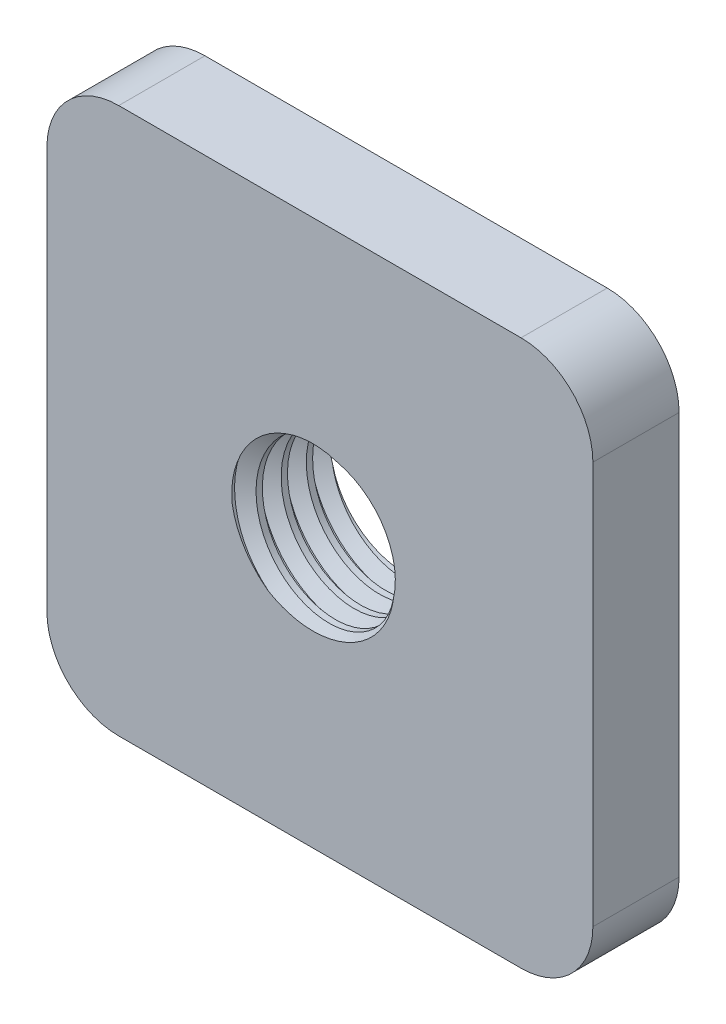
from build123d import *

# Parameters (mm, degrees)
SKETCH1_R           = 5.25
BOSS_EXTRUDE1_DEPTH = 6
THREAD1_PITCH       = 1.75


with BuildPart() as part:
    # Sketch1 → Boss-Extrude1 (new body)
    with BuildSketch(Plane.XY):
        with BuildLine():
            Line((-5, 0), (-33, 0))
            ThreePointArc((-33, 0), (-36.535533906, 1.464466094), (-38, 5))
            Line((-38, 5), (-38, 33))
            ThreePointArc((-38, 33), (-36.535533906, 36.535533906), (-33, 38))
            Line((-33, 38), (-5, 38))
            ThreePointArc((-5, 38), (-1.464466094, 36.535533906), (0, 33))
            Line((0, 33), (0, 5))
            ThreePointArc((0, 5), (-1.464466094, 1.464466094), (-5, 0))
        make_face()
        with Locations((-19, 19)):
            Circle(SKETCH1_R, mode=Mode.SUBTRACT)
    extrude(amount=BOSS_EXTRUDE1_DEPTH)

    # Thread1: the profile of Thread Profile1 profile screwed along a right-hand helix of 11.428571 turns, 10 arcs to a turn; built about Z, then put on its axis
    thread1_z = Axis((0, 0, 0), (0, 0, 1))
    thread1_corners = [(5.2497, 0, -0.000173205), (6.197215281, 0, 0.546874998), (6.197215281, 0, 0.765624998), (5.2497, 0, 1.3126732)]
    with BuildLine(mode=Mode.PRIVATE) as thread1_profile:
        Line(thread1_corners[0], thread1_corners[1])
        Line(thread1_corners[1], thread1_corners[2])
        Line(thread1_corners[2], thread1_corners[3])
        Line(thread1_corners[3], thread1_corners[0])
    thread1_cap = Face(thread1_profile.wire())
    thread1_turn_angles = [0, 18, 36, 54, 72, 90, 108, 126, 144, 162, 180, 198, 216, 234, 252, 270, 288, 306, 324, 342, 360]
    thread1_turn_weights = [1, 0.9510565162951535, 1, 0.9510565162951535, 1, 0.9510565162951535, 1, 0.9510565162951535, 1, 0.9510565162951535, 1, 0.9510565162951535, 1, 0.9510565162951535, 1, 0.9510565162951535, 1, 0.9510565162951535, 1, 0.9510565162951535, 1]
    thread1_turn_rails = [Edge.make_bspline([Vector(p[0], p[1], 0).rotate(thread1_z, thread1_turn_angles[k]) / thread1_turn_weights[k] + Vector(0, 0, p[2] + THREAD1_PITCH * thread1_turn_angles[k] / 360) for k in range(21)], [0, 0, 0, 1, 1, 2, 2, 3, 3, 4, 4, 5, 5, 6, 6, 7, 7, 8, 8, 9, 9, 10, 10, 10], 2, thread1_turn_weights) for p in thread1_corners]
    thread1_turn_sides = [Face.make_surface_from_curves(thread1_turn_rails[p[0]], thread1_turn_rails[p[1]]) for p in [(0, 1), (1, 2), (2, 3), (3, 0)]]
    thread1_last_angles = [3960, 3978, 3996, 4014, 4032, 4050, 4068, 4086, 4104, 4109.142857143, 4114.285714286]
    thread1_last_weights = [1, 0.9510565162951535, 1, 0.9510565162951535, 1, 0.9510565162951535, 1, 0.9510565162951535, 1, 0.9959742939952387, 1]
    thread1_last_rails = [Edge.make_bspline([Vector(p[0], p[1], 0).rotate(thread1_z, thread1_last_angles[k]) / thread1_last_weights[k] + Vector(0, 0, p[2] + THREAD1_PITCH * thread1_last_angles[k] / 360) for k in range(11)], [0, 0, 0, 1, 1, 2, 2, 3, 3, 4, 4, 5, 5, 5], 2, thread1_last_weights) for p in thread1_corners]
    thread1_last_sides = [Face.make_surface_from_curves(thread1_last_rails[p[0]], thread1_last_rails[p[1]]) for p in [(0, 1), (1, 2), (2, 3), (3, 0)]]
    thread1 = Plane(origin=(-19, 19, 10), x_dir=(-1, 0, 0), z_dir=(0, 0, -1)) * Solid(Shell([*[p.moved(Location((0, 0, THREAD1_PITCH * i))) for i in range(11) for p in thread1_turn_sides], *thread1_last_sides, thread1_cap, thread1_cap.rotate(thread1_z, 4114.285714286).moved(Location((0, 0, THREAD1_PITCH * 4114.285714286 / 360)))]))
    add(thread1, mode=Mode.SUBTRACT)


solid = part.part
